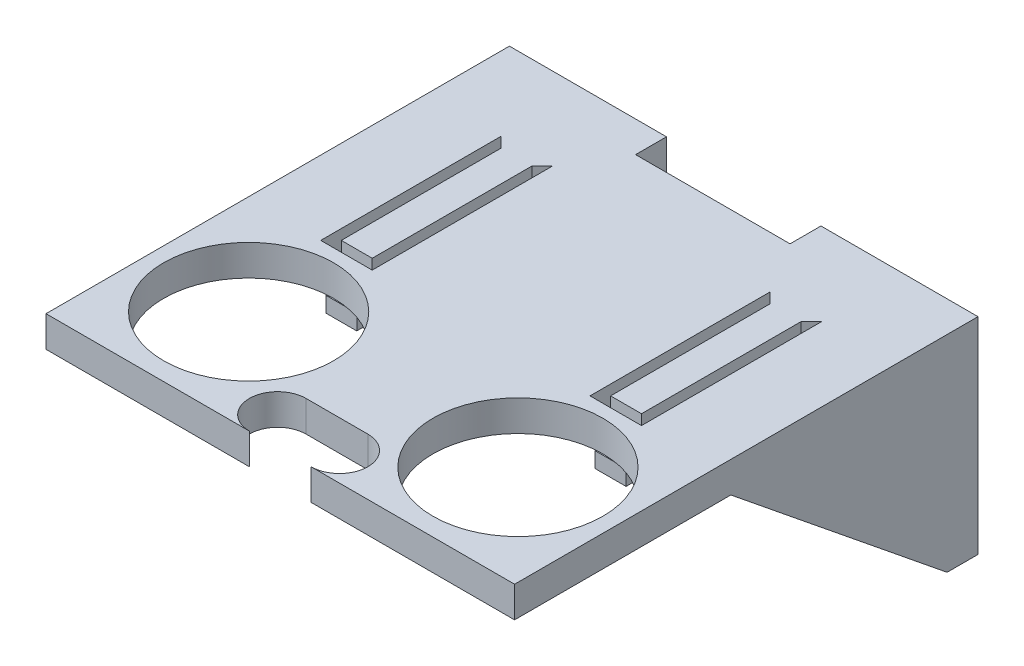
from build123d import *

# Parameters (mm, degrees)
SKETCH1_W             = 15.25
SKETCH1_H             = 20
SKETCH1_R             = 2.25
BOSS_EXTRUDE1_DEPTH   = 3
BOSS_EXTRUDE1_2_DEPTH = 3
SKETCH2_W             = 45.5
SKETCH2_H             = 3
BOSS_EXTRUDE2_DEPTH   = 42
SKETCH3_R             = 8.25
CUT_EXTRUDE1_DEPTH    = 61.44447165
BOSS_EXTRUDE3_DEPTH   = 2
LPATTERN1_COUNT       = 2
LPATTERN1_PITCH       = 43.5
CUT_EXTRUDE2_DEPTH    = 61.44447165
BOSS_EXTRUDE4_DEPTH   = 3
CUT_EXTRUDE3_DEPTH    = 61.44447165
SKETCH10_W            = 10
SKETCH10_H            = 2.5
CUT_EXTRUDE4_DEPTH    = 2
BOSS_EXTRUDE5_REACH   = 66.609
SKETCH13_W            = 3
SKETCH13_H            = 11.133974596
CUT_EXTRUDE6_DEPTH    = 1
CHAMFER1_SIZE         = 1
BOSS_EXTRUDE6_DEPTH   = 13.25
CHAMFER2_SIZE         = 1


with BuildPart() as part:
    # Sketch1 → Boss-Extrude1 (new body)
    with BuildSketch(Plane.XY):
        with Locations((-28.974646897, 6.034741944)):
            Rectangle(SKETCH1_W, SKETCH1_H)
        with Locations((-29.599646897, 6.034741944)):
            Circle(SKETCH1_R, mode=Mode.SUBTRACT)
    extrude(amount=BOSS_EXTRUDE1_DEPTH)


with BuildPart() as body_2:
    # Sketch1 → Boss-Extrude1 2 (new body)
    with BuildSketch(Plane.XY):
        with Locations((1.275353103, 6.034741944)):
            Rectangle(SKETCH1_W, SKETCH1_H)
        with Locations((1.900353103, 6.034741944)):
            Circle(SKETCH1_R, mode=Mode.SUBTRACT)
    extrude(amount=BOSS_EXTRUDE1_2_DEPTH)



with BuildPart() as body_3:
    # Sketch2 → Boss-Extrude2 (new body)
    with BuildSketch(Plane.XY.offset(3)):
        with Locations((-13.849646897, 14.534741944)):
            Rectangle(SKETCH2_W, SKETCH2_H)
    extrude(amount=BOSS_EXTRUDE2_DEPTH)

    # Sketch3 → Cut-Extrude1 (cut, through all)
    with BuildSketch(Plane(origin=(0, 13.034741944, 0), x_dir=(-1, 0, 0), z_dir=(0, -1, 0))):
        with Locations(Location((26.924646897, -35, 0), (0, 0, 90))):
            Circle(SKETCH3_R)
        with Locations(Location((0.774646897, -35, 0), (0, 0, 90))):
            Circle(SKETCH3_R)
    extrude(amount=-CUT_EXTRUDE1_DEPTH, mode=Mode.SUBTRACT)


with BuildPart() as body_2_1:
    add(body_2.part)

    add(body_3.part)  # Boss-Extrude3 merges body 3
    # Sketch4 → Boss-Extrude3 (add)
    with BuildSketch(Plane(origin=(8.900353103, 0, 0), x_dir=(0, 0, -1), z_dir=(1, 0, 0))):
        Polygon((-3, -3.965258056), (-24, 13.034741944), (-3, 13.034741944), align=None)
    boss_extrude3 = extrude(amount=-BOSS_EXTRUDE3_DEPTH)


with BuildPart() as part_1:
    add(part.part)

    add(body_2_1.part)  # LPattern1 merges body 2
    # LPattern1: Boss-Extrude3 ×2
    with Locations(*[(-i * LPATTERN1_PITCH, 0, 0) for i in range(1, LPATTERN1_COUNT)]):
        add(boss_extrude3)

    # Sketch5 → Cut-Extrude2 (cut, through all)
    with BuildSketch(Plane(origin=(0, 13.034741944, 0), x_dir=(-1, 0, 0), z_dir=(0, -1, 0))):
        Polygon((29.424646897, -8), (29.424646897, -25.5), (24.424646897, -25.5), (24.424646897, -8), (25.424646897, -8), (25.424646897, -24.5), (28.424646897, -24.5), (28.424646897, -8), align=None)
        Polygon((-0.725353103, -8), (-1.725353103, -8), (-1.725353103, -25.5), (3.274646897, -25.5), (3.274646897, -8), (2.274646897, -8), (2.274646897, -24.5), (-0.725353103, -24.5), align=None)
    extrude(amount=-CUT_EXTRUDE2_DEPTH, mode=Mode.SUBTRACT)

    # Sketch6 → Boss-Extrude4 (add)
    with BuildSketch(Plane(origin=(-25.424646897, 0, 0), x_dir=(0, 0, -1), z_dir=(1, 0, 0))):
        Polygon((-24.5, 13.034741944), (-26, 12.16871654), (-26, 10.66871654), (-21.5, 10.66871654), (-19.133974596, 13.034741944), align=None)
    boss_extrude4 = extrude(amount=-BOSS_EXTRUDE4_DEPTH)

    # Mirror7: Boss-Extrude4 across plane
    add(boss_extrude4.mirror(Plane(origin=(-13.849646897, 13.034741944, 8), x_dir=(0, 0, 1), z_dir=(1, 0, 0))))

    # Sketch9 → Cut-Extrude3 (cut, through all)
    with BuildSketch(Plane(origin=(0, 13.034741944, 0), x_dir=(-1, 0, 0), z_dir=(0, -1, 0))):
        with BuildLine():
            Line((16.849646897, -45), (10.849646897, -45))
            ThreePointArc((10.849646897, -45), (8.099646897, -42.25), (10.849646897, -39.5))
            Line((10.849646897, -39.5), (16.849646897, -39.5))
            ThreePointArc((16.849646897, -39.5), (19.599646897, -42.25), (16.849646897, -45))
        make_face()
    extrude(amount=-CUT_EXTRUDE3_DEPTH, mode=Mode.SUBTRACT)

    # Sketch10 → Cut-Extrude4 (cut)
    with BuildSketch(Plane(origin=(0, 13.034741944, 0), x_dir=(-1, 0, 0), z_dir=(0, -1, 0))):
        with Locations((13.849646897, -26.25)):
            Rectangle(SKETCH10_W, SKETCH10_H)
    extrude(amount=-CUT_EXTRUDE4_DEPTH, mode=Mode.SUBTRACT)

    # Boss-Extrude5: up to this face of the body (flat: up to its plane)
    boss_extrude5_end = Plane(part_1.part.faces().sort_by_distance((6.900353103, 7.368075277, 10))[0])
    # Sketch11 → Boss-Extrude5 (add, up to the picked face)
    with BuildSketch(Plane(origin=(-34.599646897, 0, 0), x_dir=(0, 0, -1), z_dir=(1, 0, 0)), mode=Mode.PRIVATE) as boss_extrude5_sk1:
        Polygon((-5.617808219, -1.846079974), (-3, -3.965258056), (-3, -0.465258056), (-4.5, -0.465258056), align=None)
    boss_extrude5_tool1 = split(extrude(boss_extrude5_sk1.sketch, amount=BOSS_EXTRUDE5_REACH, mode=Mode.PRIVATE), bisect_by=boss_extrude5_end, keep=Keep.BOTH, mode=Mode.PRIVATE)
    add(boss_extrude5_tool1.solids().sort_by(Axis((-34.599647, -1.87709, 3.964792), (1, 0, 0)))[0])

    # Sketch13 → Cut-Extrude6 (cut)
    with BuildSketch(Plane(origin=(0, 13.034741944, 0), x_dir=(-1, 0, 0), z_dir=(0, -1, 0))):
        with Locations((26.924646897, -13.566987298)):
            Rectangle(SKETCH13_W, SKETCH13_H)
        with Locations((0.774646897, -13.566987298)):
            Rectangle(SKETCH13_W, SKETCH13_H)
    extrude(amount=-CUT_EXTRUDE6_DEPTH, mode=Mode.SUBTRACT)

    # Chamfer1
    chamfer1_edges = [part_1.edges().sort_by_distance(p)[0] for p in [
        (-26.924646897, 14.034741944, 8),
        (-0.774646897, 14.034741944, 8),
    ]]
    chamfer(chamfer1_edges, length=CHAMFER1_SIZE - 0.0001)  # a hair under: the kernel refuses the full size

    # Sketch11<3> → Boss-Extrude6 (add)
    with BuildSketch(Plane(origin=(-34.599646897, 0, 0), x_dir=(0, 0, -1), z_dir=(1, 0, 0))):
        Polygon((-4.5, -0.465258056), (-3, -0.465258056), (-3, 1.38768312), align=None)
    boss_extrude6 = extrude(amount=BOSS_EXTRUDE6_DEPTH)

    # Mirror8: Boss-Extrude6 across plane
    add(boss_extrude6.mirror(Plane(origin=(-13.849646897, 13.034741944, 8), x_dir=(0, 0, 1), z_dir=(1, 0, 0))))

    # Chamfer2
    chamfer2_edges = [part_1.edges().sort_by_distance(p)[0] for p in [
        (-28.424646897, 14.534791944, 8),
        (-2.274646897, 14.534791944, 8),
        (-25.424646897, 14.534791944, 8),
        (0.725353103, 14.534791944, 8),
    ]]
    chamfer(chamfer2_edges, length=CHAMFER2_SIZE - 0.0001)  # a hair under: the kernel refuses the full size


solid = part_1.part
